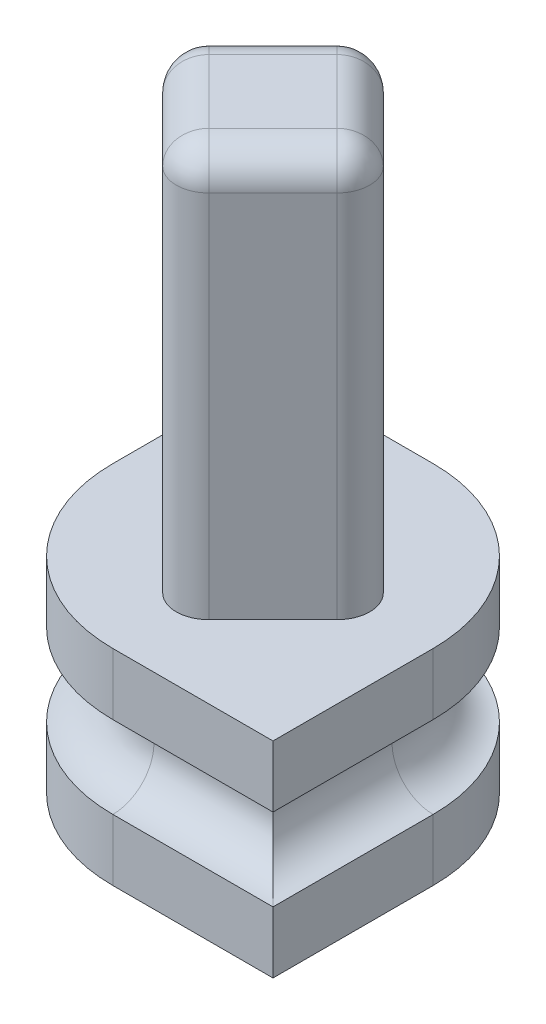
from build123d import *

# Parameters (mm, degrees)
BOSS_EXTRUDE1_DEPTH     = 5
BOSS_EXTRUDE2_DEPTH     = 9.8
CUT_EXTRUDE2_DEPTH      = 1
CUT_EXTRUDE2_DEPTH_BACK = 1
FILLET1_R               = 1
FILLET3_R               = 0.8


with BuildPart() as part:
    # Sketch1 → Boss-Extrude1 (new body)
    with BuildSketch(Plane(origin=(0, 0, 0), x_dir=(1, 0, 0), z_dir=(0, 1, 0))):
        with BuildLine():
            Line((-3.9, 3.9), (0, 3.9))
            ThreePointArc((0, 3.9), (2.757716447, 2.757716447), (3.9, 0))
            Line((3.9, 0), (3.9, -3.9))
            Line((3.9, -3.9), (0, -3.9))
            ThreePointArc((0, -3.9), (-2.757716447, -2.757716447), (-3.9, 0))
            Line((-3.9, 0), (-3.9, 3.9))
        make_face()
    extrude(amount=BOSS_EXTRUDE1_DEPTH)

    # Sketch2 → Boss-Extrude2 (add)
    with BuildSketch(Plane(origin=(0, 5, 0), x_dir=(1, 0, 0), z_dir=(0, 1, 0))):
        with BuildLine():
            Line((-0.565685425, 2.121320344), (-2.121320344, 0.565685425))
            ThreePointArc((-2.121320344, 0.565685425), (-2.355634919, 0), (-2.121320344, -0.565685425))
            Line((-2.121320344, -0.565685425), (-0.565685425, -2.121320344))
            ThreePointArc((-0.565685425, -2.121320344), (0, -2.355634919), (0.565685425, -2.121320344))
            Line((0.565685425, -2.121320344), (2.121320344, -0.565685425))
            ThreePointArc((2.121320344, -0.565685425), (2.355634919, 0), (2.121320344, 0.565685425))
            Line((2.121320344, 0.565685425), (0.565685425, 2.121320344))
            ThreePointArc((0.565685425, 2.121320344), (0, 2.355634919), (-0.565685425, 2.121320344))
        make_face()
    extrude(amount=BOSS_EXTRUDE2_DEPTH)

    # Sketch3 → Cut-Extrude2 (cut, two sides: drawn at the far end of the back side and taken through both)
    with BuildSketch(Plane(origin=(0, 2.5, 0), x_dir=(1, 0, 0), z_dir=(0, 1, 0)).offset(-CUT_EXTRUDE2_DEPTH_BACK)):
        with BuildLine():
            Line((-3.9, 0), (-3.9, 3.9))
            Line((-3.9, 3.9), (0, 3.9))
            ThreePointArc((0, 3.9), (2.757716447, 2.757716447), (3.9, 0))
            Line((3.9, 0), (3.9, -3.9))
            Line((3.9, -3.9), (0, -3.9))
            ThreePointArc((0, -3.9), (-2.757716447, -2.757716447), (-3.9, 0))
        make_face()
        with BuildLine():
            Line((-2.9, 0), (-2.9, 2.9))
            Line((-2.9, 2.9), (0, 2.9))
            ThreePointArc((0, 2.9), (2.050609665, 2.050609665), (2.9, 0))
            Line((2.9, 0), (2.9, -2.9))
            Line((2.9, -2.9), (0, -2.9))
            ThreePointArc((0, -2.9), (-2.050609665, -2.050609665), (-2.9, 0))
        make_face(mode=Mode.SUBTRACT)
    extrude(amount=CUT_EXTRUDE2_DEPTH + CUT_EXTRUDE2_DEPTH_BACK, mode=Mode.SUBTRACT)

    # Fillet1
    fillet1_edges = [part.edges().sort_by_distance(p)[0] for p in [
        (2.9, 3.5, 1.45),
        (2.050609665, 3.5, -2.050609665),
        (1.45, 3.5, 2.9),
        (-2.050609665, 3.5, 2.050609665),
        (2.9, 1.5, 1.45),
        (2.050609665, 1.5, -2.050609665),
        (-2.9, 1.5, -1.45),
        (1.45, 1.5, 2.9),
        (-1.45, 3.5, -2.9),
        (-2.9, 3.5, -1.45),
        (-1.45, 1.5, -2.9),
        (-2.050609665, 1.5, 2.050609665),
    ]]
    fillet(fillet1_edges, radius=FILLET1_R - 0.0001)  # a hair under: the kernel refuses the full size

    # Fillet3
    fillet3_edges = [part.edges().sort_by_distance(p)[0] for p in [
        (0, 14.8, 2.355634919),
        (1.343502884, 14.8, 1.343502884),
        (2.355634919, 14.8, 0),
        (1.343502884, 14.8, -1.343502884),
        (0, 14.8, -2.355634919),
        (-1.343502884, 14.8, -1.343502884),
        (-2.355634919, 14.8, 0),
        (-1.343502884, 14.8, 1.343502884),
    ]]
    fillet(fillet3_edges, radius=FILLET3_R)


solid = part.part
